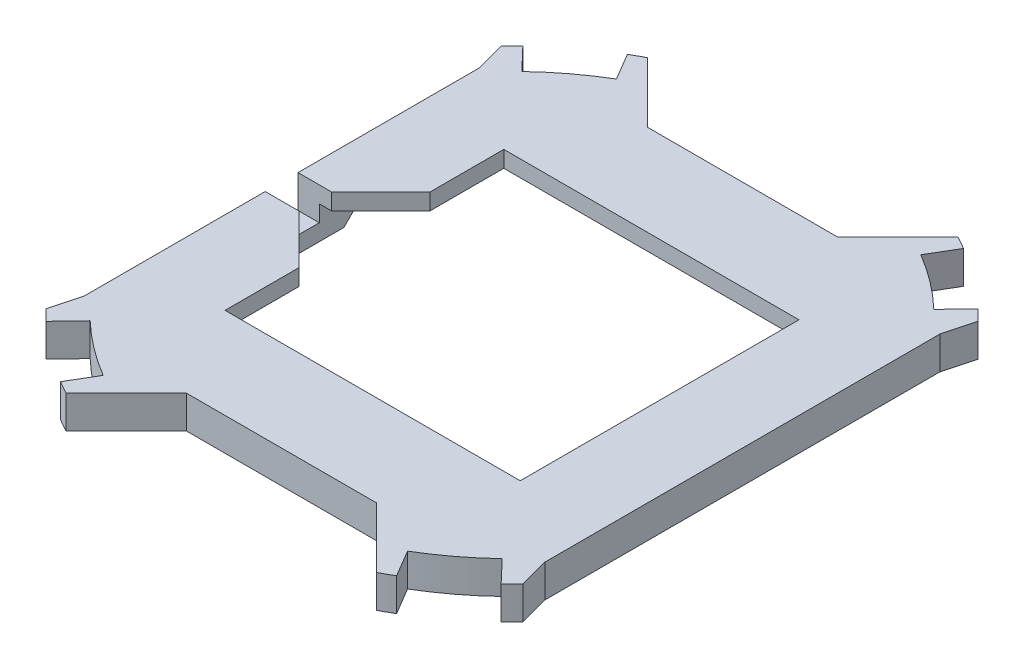
from build123d import *

# Parameters (mm, degrees)
BOSS_EXTRUDE3_DEPTH      = 1
BOSS_EXTRUDE3_DEPTH_BACK = 1
SKETCH3_W                = 18
SKETCH3_H                = 17
CUT_EXTRUDE1_DEPTH       = 23.944525539
SKETCH3_4_W              = 25.5
SKETCH3_4_H              = 25.5
SKETCH3_4_W_2            = 18
SKETCH3_4_H_2            = 17
CUT_EXTRUDE3_DEPTH       = 23.944525539
CUT_EXTRUDE4_DEPTH       = 23.944525539
CUT_EXTRUDE4_DEPTH_BACK  = 23.944525539
SKETCH4_W                = 16
SKETCH4_H                = 2
CHAMFER1_SIZE            = 3
SKETCH6_W                = 5
SKETCH6_H                = 1
BOSS_EXTRUDE5_DEPTH      = 1.3
CHAMFER2_SIZE            = 1


with BuildPart() as part:
    # Sketch2 → Boss-Extrude3 (new, two sides: drawn at the far end of the back side and taken through both)
    with BuildSketch(Plane(origin=(0, -16.832566415, 0), x_dir=(1, 0, 0), z_dir=(0, 1, 0)).offset(-BOSS_EXTRUDE3_DEPTH_BACK)):
        with BuildLine():
            Line((14.05, -12.05), (14.05, 12.05))
            Line((14.05, 12.05), (14.538378439, 13.872653149))
            ThreePointArc((14.538378439, 13.872653149), (14.210517369, 14.208312678), (13.874908715, 14.536225824))
            Line((13.874908715, 14.536225824), (12.56303347, 13.16182292))
            ThreePointArc((12.56303347, 13.16182292), (10.992315824, 14.499392587), (9.280277793, 15.650553876))
            Line((9.280277793, 15.650553876), (10.249356378, 17.284838642))
            ThreePointArc((10.249356378, 17.284838642), (9.863353095, 17.507975862), (9.47249431, 17.72249431))
            Line((9.47249431, 17.72249431), (5.8, 14.05))
            Line((5.8, 14.05), (-5.8, 14.05))
            Line((-5.8, 14.05), (-9.47249431, 17.72249431))
            ThreePointArc((-9.47249431, 17.72249431), (-9.863353095, 17.507975862), (-10.249356378, 17.284838642))
            Line((-10.249356378, 17.284838642), (-9.280277793, 15.650553876))
            ThreePointArc((-9.280277793, 15.650553876), (-10.992315824, 14.499392587), (-12.56303347, 13.16182292))
            Line((-12.56303347, 13.16182292), (-13.874908715, 14.536225824))
            ThreePointArc((-13.874908715, 14.536225824), (-14.210517369, 14.208312678), (-14.538378439, 13.872653149))
            Line((-14.538378439, 13.872653149), (-14.05, 12.05))
            Line((-14.05, 12.05), (-14.05, -12.05))
            Line((-14.05, -12.05), (-14.538378439, -13.872653149))
            ThreePointArc((-14.538378439, -13.872653149), (-14.210517369, -14.208312678), (-13.874908715, -14.536225824))
            Line((-13.874908715, -14.536225824), (-12.56303347, -13.16182292))
            ThreePointArc((-12.56303347, -13.16182292), (-10.992315824, -14.499392587), (-9.280277793, -15.650553876))
            Line((-9.280277793, -15.650553876), (-10.249356378, -17.284838642))
            ThreePointArc((-10.249356378, -17.284838642), (-9.863353095, -17.507975862), (-9.47249431, -17.72249431))
            Line((-9.47249431, -17.72249431), (-5.8, -14.05))
            Line((-5.8, -14.05), (5.8, -14.05))
            Line((5.8, -14.05), (9.47249431, -17.72249431))
            ThreePointArc((9.47249431, -17.72249431), (9.863353095, -17.507975862), (10.249356378, -17.284838642))
            Line((10.249356378, -17.284838642), (9.280277793, -15.650553876))
            ThreePointArc((9.280277793, -15.650553876), (10.992315824, -14.499392587), (12.56303347, -13.16182292))
            Line((12.56303347, -13.16182292), (13.874908715, -14.536225824))
            ThreePointArc((13.874908715, -14.536225824), (14.210517369, -14.208312678), (14.538378439, -13.872653149))
            Line((14.538378439, -13.872653149), (14.05, -12.05))
        make_face()
    extrude(amount=BOSS_EXTRUDE3_DEPTH + BOSS_EXTRUDE3_DEPTH_BACK)

    # Sketch3 → Cut-Extrude1 (cut, through all)
    with BuildSketch(Plane(origin=(0, -16.832566415, 0), x_dir=(1, 0, 0), z_dir=(0, 1, 0))):
        Rectangle(SKETCH3_W, SKETCH3_H)
    extrude(amount=CUT_EXTRUDE1_DEPTH, mode=Mode.SUBTRACT)

    # Sketch3<4> → Cut-Extrude3 (cut, through all)
    # profile 1 of 2: a face of its own
    with BuildSketch(Plane(origin=(0, -16.832566415, 0), x_dir=(1, 0, 0), z_dir=(0, 1, 0))):
        Rectangle(SKETCH3_4_W, SKETCH3_4_H)
        Rectangle(SKETCH3_4_W_2, SKETCH3_4_H_2, mode=Mode.SUBTRACT)
    # profile 2 of 2: a face of its own
    with BuildSketch(Plane(origin=(0, -16.832566415, 0), x_dir=(1, 0, 0), z_dir=(0, 1, 0))):
        Rectangle(SKETCH3_4_W_2, SKETCH3_4_H_2)
    extrude(amount=-CUT_EXTRUDE3_DEPTH, mode=Mode.SUBTRACT)

    # Sketch4 → Cut-Extrude4 (cut, two sides: drawn at the far end of the back side and taken through both)
    with BuildSketch(Plane(origin=(0, -16.832566415, 0), x_dir=(1, 0, 0), z_dir=(0, 1, 0)).offset(-CUT_EXTRUDE4_DEPTH_BACK)):
        with Locations((-13.844488576, 0)):
            Rectangle(SKETCH4_W, SKETCH4_H)
    extrude(amount=CUT_EXTRUDE4_DEPTH + CUT_EXTRUDE4_DEPTH_BACK, mode=Mode.SUBTRACT)

    # Chamfer1
    chamfer1_edges = [part.edges().sort_by_distance(p)[0] for p in [
        (-9, -16.332566415, -1),
        (-9, -16.332566415, 1),
    ]]
    chamfer(chamfer1_edges, length=CHAMFER1_SIZE)

    # Sketch6 → Boss-Extrude5 (add)
    with BuildSketch(Plane.ZY.offset(14.05)):
        with Locations((0, -18.332566415)):
            Rectangle(SKETCH6_W, SKETCH6_H)
    extrude(amount=-BOSS_EXTRUDE5_DEPTH)

    # Chamfer2
    chamfer2_edges = [part.edges().sort_by_distance(p)[0] for p in [
        (-13.4, -17.832566415, 2.5),
        (-13.4, -17.832566415, -2.5),
    ]]
    chamfer(chamfer2_edges, length=CHAMFER2_SIZE - 0.0001)  # a hair under: the kernel refuses the full size


solid = part.part
